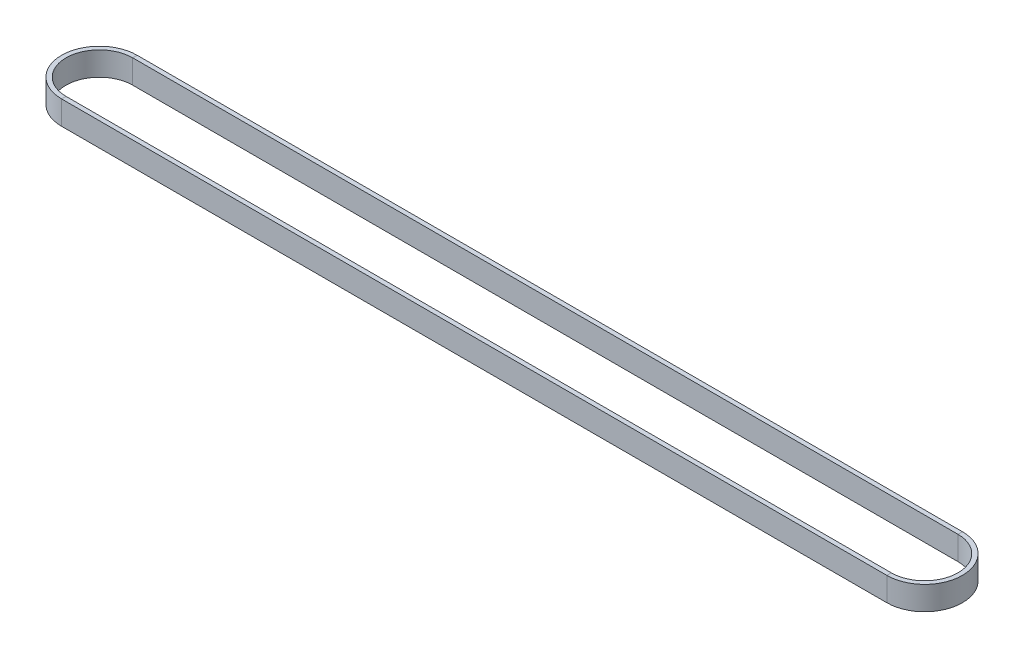
from build123d import *

# Parameters (mm, degrees)
SKETCH2_W = 1.905
SKETCH2_H = 10.16


with BuildPart() as part:
    # Sweep1: sweep along a path in Sketch1
    with BuildLine(Plane(origin=(0, 0, 0), x_dir=(1, 0, 0), z_dir=(0, 1, 0))) as sweep1_path:
        Line((0, 15.24), (353.516530202, 15.24))
        ThreePointArc((353.516530202, 15.24), (368.756530202, 0), (353.516530202, -15.24))
        Line((353.516530202, -15.24), (0, -15.24))
        ThreePointArc((0, -15.24), (-15.24, 0), (0, 15.24))
    # Sketch2 → Sweep1 (sweep)
    with BuildSketch(Plane(origin=(0, 0, 0), x_dir=(0, 0, -1), z_dir=(1, 0, 0))):
        with Locations((-15.24, 0)):
            Rectangle(SKETCH2_W, SKETCH2_H)
    sweep(path=sweep1_path.line)


solid = part.part
